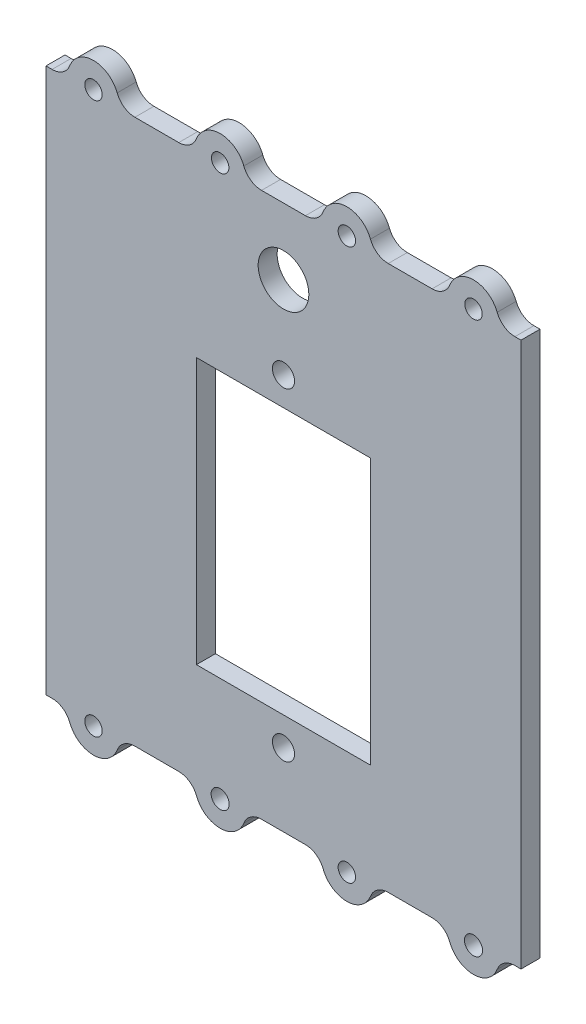
from build123d import *

# Parameters (mm, degrees)
SKETCH1_R           = 1.375
SKETCH1_R_2         = 1.428571429
BOSS_EXTRUDE1_DEPTH = 3
SKETCH2_R           = 4
SKETCH2_R_2         = 1.75
SKETCH2_W           = 27.5
SKETCH2_H           = 42
CUT_EXTRUDE1_DEPTH  = 61.592903875


with BuildPart() as part:
    # Sketch1 → Boss-Extrude1 (new body)
    with BuildSketch(Plane.XY):
        with BuildLine():
            Line((-3.461651585, -43), (3.461651585, -43))
            ThreePointArc((3.461651585, -43), (5.162491713, -43.528736587), (6.263800906, -44.928571429))
            ThreePointArc((6.263800906, -44.928571429), (10, -47.5), (13.736199094, -44.928571429))
            ThreePointArc((13.736199094, -44.928571429), (14.837508287, -43.528736587), (16.538348415, -43))
            Line((16.538348415, -43), (23.461651585, -43))
            ThreePointArc((23.461651585, -43), (25.162491713, -43.528736587), (26.263800906, -44.928571429))
            ThreePointArc((26.263800906, -44.928571429), (30, -47.5), (33.736199094, -44.928571429))
            ThreePointArc((33.736199094, -44.928571429), (34.837508287, -43.528736587), (36.538348415, -43))
            Line((36.538348415, -43), (37.5, -43))
            Line((37.5, -43), (37.5, 43))
            Line((37.5, 43), (36.538348415, 43))
            ThreePointArc((36.538348415, 43), (34.837508287, 43.528736587), (33.736199094, 44.928571429))
            ThreePointArc((33.736199094, 44.928571429), (30, 47.5), (26.263800906, 44.928571429))
            ThreePointArc((26.263800906, 44.928571429), (25.162491713, 43.528736587), (23.461651585, 43))
            Line((23.461651585, 43), (16.538348415, 43))
            ThreePointArc((16.538348415, 43), (14.837508287, 43.528736587), (13.736199094, 44.928571429))
            ThreePointArc((13.736199094, 44.928571429), (10, 47.5), (6.263800906, 44.928571429))
            ThreePointArc((6.263800906, 44.928571429), (5.162491713, 43.528736587), (3.461651585, 43))
            Line((3.461651585, 43), (-3.461651585, 43))
            ThreePointArc((-3.461651585, 43), (-5.162491713, 43.528736587), (-6.263800906, 44.928571429))
            ThreePointArc((-6.263800906, 44.928571429), (-10, 47.5), (-13.736199094, 44.928571429))
            ThreePointArc((-13.736199094, 44.928571429), (-14.837508287, 43.528736587), (-16.538348415, 43))
            Line((-16.538348415, 43), (-23.461651585, 43))
            ThreePointArc((-23.461651585, 43), (-25.162491713, 43.528736587), (-26.263800906, 44.928571429))
            ThreePointArc((-26.263800906, 44.928571429), (-30, 47.5), (-33.736199094, 44.928571429))
            ThreePointArc((-33.736199094, 44.928571429), (-34.837508287, 43.528736587), (-36.538348415, 43))
            Line((-36.538348415, 43), (-37.5, 43))
            Line((-37.5, 43), (-37.5, -43))
            Line((-37.5, -43), (-36.538348415, -43))
            ThreePointArc((-36.538348415, -43), (-34.837508287, -43.528736587), (-33.736199094, -44.928571429))
            ThreePointArc((-33.736199094, -44.928571429), (-30, -47.5), (-26.263800906, -44.928571429))
            ThreePointArc((-26.263800906, -44.928571429), (-25.162491713, -43.528736587), (-23.461651585, -43))
            Line((-23.461651585, -43), (-16.538348415, -43))
            ThreePointArc((-16.538348415, -43), (-14.837508287, -43.528736587), (-13.736199094, -44.928571429))
            ThreePointArc((-13.736199094, -44.928571429), (-10, -47.5), (-6.263800906, -44.928571429))
            ThreePointArc((-6.263800906, -44.928571429), (-5.162491713, -43.528736587), (-3.461651585, -43))
        make_face()
        with Locations((-30, 43.5)):
            Circle(SKETCH1_R, mode=Mode.SUBTRACT)
        with Locations((-10, 43.5)):
            Circle(SKETCH1_R, mode=Mode.SUBTRACT)
        with Locations((10, 43.5)):
            Circle(SKETCH1_R, mode=Mode.SUBTRACT)
        with Locations((30, 43.5)):
            Circle(SKETCH1_R, mode=Mode.SUBTRACT)
        with Locations((-30, -43.5)):
            Circle(SKETCH1_R, mode=Mode.SUBTRACT)
        with Locations((-10, -43.5)):
            Circle(SKETCH1_R_2, mode=Mode.SUBTRACT)
        with Locations((10, -43.5)):
            Circle(SKETCH1_R, mode=Mode.SUBTRACT)
        with Locations((30, -43.5)):
            Circle(SKETCH1_R_2, mode=Mode.SUBTRACT)
    extrude(amount=BOSS_EXTRUDE1_DEPTH)

    # Sketch2 → Cut-Extrude1 (cut, through all)
    with BuildSketch(Plane.XY):
        with Locations((0, 32.5)):
            Circle(SKETCH2_R)
        with Locations((0, 19.5)):
            Circle(SKETCH2_R_2)
        with Locations((0, -31.5)):
            Circle(SKETCH2_R_2)
        with Locations((0, -6)):
            Rectangle(SKETCH2_W, SKETCH2_H)
    extrude(amount=CUT_EXTRUDE1_DEPTH, mode=Mode.SUBTRACT)


solid = part.part
